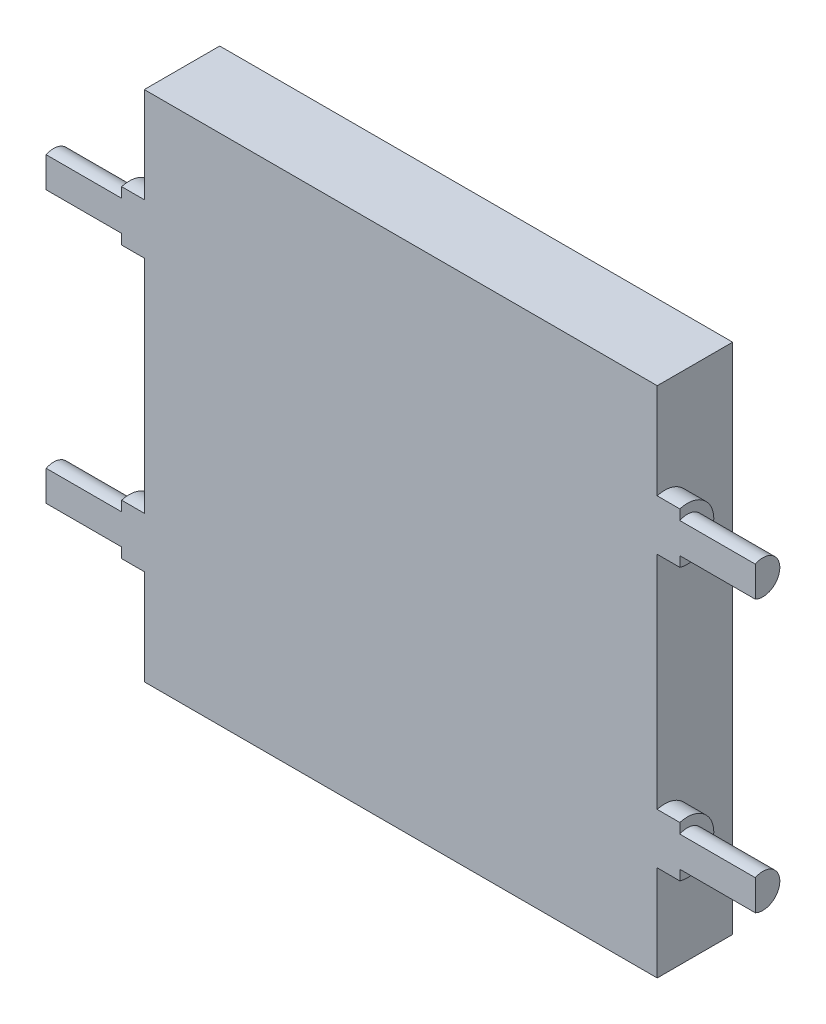
from build123d import *

# Parameters (mm, degrees)
SKETCH1_W           = 68
SKETCH1_H           = 68
BOSS_EXTRUDE1_DEPTH = 10
BOSS_EXTRUDE2_DEPTH = 3
BOSS_EXTRUDE3_DEPTH = 10
BOSS_EXTRUDE4_START = 3
BOSS_EXTRUDE4_DEPTH = 3
BOSS_EXTRUDE5_START = 10
BOSS_EXTRUDE5_DEPTH = 10
SKETCH6_W           = 42.5
SKETCH6_H           = 42.5
CUT_EXTRUDE1_DEPTH  = 3
SKETCH8_R           = 1.5
CUT_EXTRUDE2_DEPTH  = 5


with BuildPart() as part:
    # Sketch1 → Boss-Extrude1 (new body)
    with BuildSketch(Plane.XY):
        with Locations((-34, -34)):
            Rectangle(SKETCH1_W, SKETCH1_H)
    extrude(amount=BOSS_EXTRUDE1_DEPTH)

    # Sketch2 → Boss-Extrude2 (add)
    with BuildSketch(Plane.ZY.offset(68)):
        with BuildLine():
            Line((10, -55.354101966), (10, -48.645898034))
            ThreePointArc((10, -48.645898034), (5.5, -52), (10, -55.354101966))
        make_face()
        with BuildLine():
            Line((10, -19.354101966), (10, -12.645898034))
            ThreePointArc((10, -12.645898034), (5.5, -16), (10, -19.354101966))
        make_face()
    extrude(amount=BOSS_EXTRUDE2_DEPTH)

    # Sketch3 → Boss-Extrude3 (add)
    with BuildSketch(Plane.ZY.offset(71)):
        with BuildLine():
            ThreePointArc((10, -49.984435563), (6.75, -52), (10, -54.015564437))
            Line((10, -54.015564437), (10, -49.984435563))
        make_face()
        with BuildLine():
            ThreePointArc((10, -13.984435563), (6.75, -16), (10, -18.015564437))
            Line((10, -18.015564437), (10, -13.984435563))
        make_face()
    extrude(amount=BOSS_EXTRUDE3_DEPTH)

    # Sketch4 → Boss-Extrude4 (add)
    with BuildSketch(Plane(origin=(0, 0, 0), x_dir=(0, 0, -1), z_dir=(1, 0, 0)).offset(BOSS_EXTRUDE4_START)):
        with BuildLine():
            ThreePointArc((-10, -19.354101966), (-5.5, -16), (-10, -12.645898034))
            Line((-10, -12.645898034), (-10, -19.354101966))
        make_face()
        with BuildLine():
            ThreePointArc((-10, -55.354101966), (-5.5, -52), (-10, -48.645898034))
            Line((-10, -48.645898034), (-10, -55.354101966))
        make_face()
    extrude(amount=-BOSS_EXTRUDE4_DEPTH)

    # Sketch5 → Boss-Extrude5 (add)
    with BuildSketch(Plane(origin=(3, 0, 0), x_dir=(0, 0, -1), z_dir=(1, 0, 0)).offset(BOSS_EXTRUDE5_START)):
        with BuildLine():
            ThreePointArc((-10, -18.015564437), (-6.75, -16), (-10, -13.984435563))
            Line((-10, -13.984435563), (-10, -18.015564437))
        make_face()
        with BuildLine():
            ThreePointArc((-10, -54.015564437), (-6.75, -52), (-10, -49.984435563))
            Line((-10, -49.984435563), (-10, -54.015564437))
        make_face()
    extrude(amount=-BOSS_EXTRUDE5_DEPTH)

    # Sketch6 → Cut-Extrude1 (cut)
    with BuildSketch(Plane(origin=(0, 0, 0), x_dir=(-1, 0, 0), z_dir=(0, 0, -1))):
        with Locations((34, -34)):
            Rectangle(SKETCH6_W, SKETCH6_H)
    extrude(amount=-CUT_EXTRUDE1_DEPTH, mode=Mode.SUBTRACT)

    # Sketch8 → Cut-Extrude2 (cut)
    with BuildSketch(Plane(origin=(0, 0, 0), x_dir=(-1, 0, 0), z_dir=(0, 0, -1))):
        with Locations((4.75, -17.75)):
            Circle(SKETCH8_R)
        with Locations((4.75, -50.25)):
            Circle(SKETCH8_R)
        with Locations((63.25, -50.25)):
            Circle(SKETCH8_R)
        with Locations((63.25, -17.75)):
            Circle(SKETCH8_R)
    extrude(amount=-CUT_EXTRUDE2_DEPTH, mode=Mode.SUBTRACT)


solid = part.part
